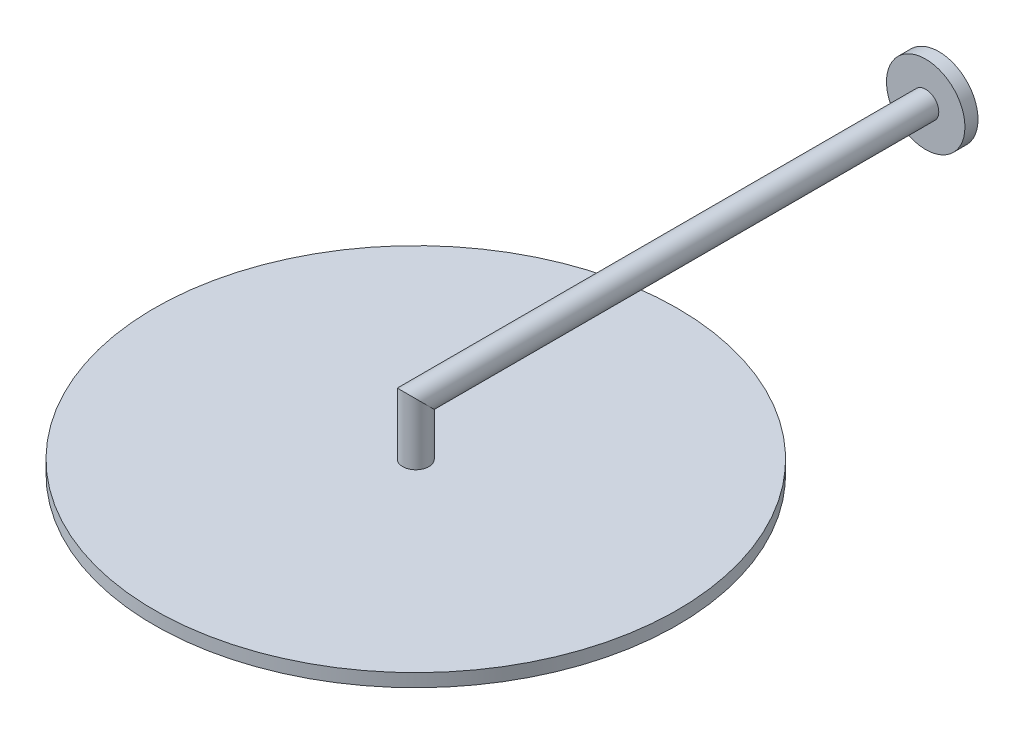
from build123d import *

# Parameters (mm, degrees)
SKETCH_1_R        = 30
EXTRUDE_1_DEPTH   = 10
SWEEP_1_PROFILE_R = 10
SKETCH_7_R        = 200
EXTRUDE_2_DEPTH   = 10


with BuildPart() as part:
    # Эскиз1 → Бобышка-Вытянуть1 (new body)
    with BuildSketch(Plane.XY):
        Circle(SKETCH_1_R)
    extrude(amount=EXTRUDE_1_DEPTH)

    # По траектории1: sweep along a curve in space
    with BuildLine() as sweep_1_path:
        Line((0, 0, 0), (0, 0, 400))
        Line((0, 0, 400), (0, -40, 400))
    # По траектории1 profile (on start of the path) → По траектории1 (sweep)
    with BuildSketch(Plane.XY):
        Circle(SWEEP_1_PROFILE_R)
    sweep(path=sweep_1_path.line, transition=Transition.RIGHT)

    # Эскиз7 → Бобышка-Вытянуть2 (add)
    with BuildSketch(Plane(origin=(0, -40, 0), x_dir=(-1, 0, 0), z_dir=(0, -1, 0))):
        with Locations((0, -400)):
            Circle(SKETCH_7_R)
    extrude(amount=EXTRUDE_2_DEPTH)


solid = part.part
